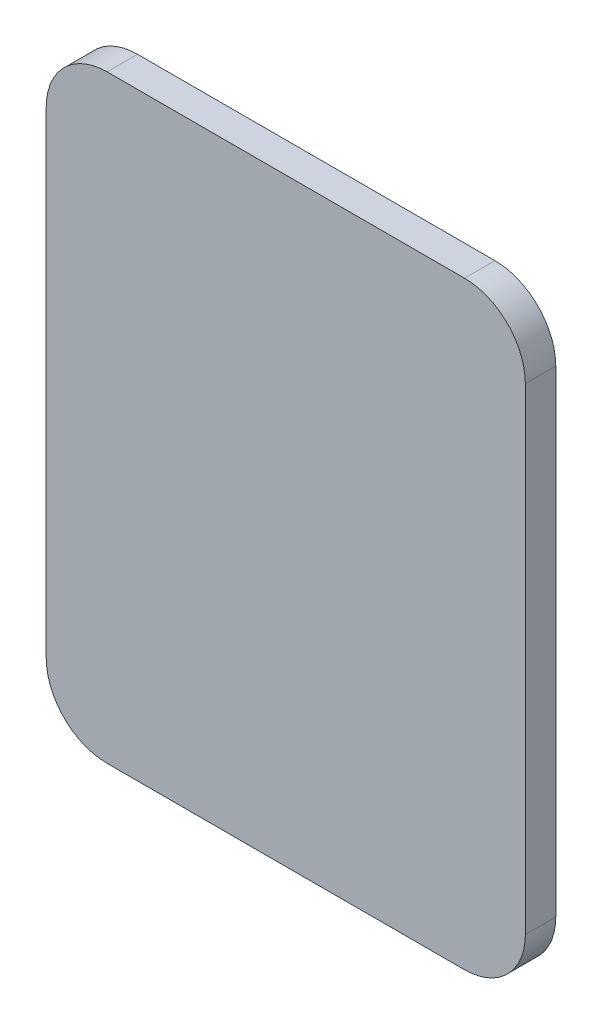
from build123d import *

# Parameters (mm, degrees)
BOSS_EXTRUDE1_DEPTH = 2.54


with BuildPart() as part:
    # Sketch1 → Boss-Extrude1 (new body)
    with BuildSketch(Plane.XY):
        with BuildLine():
            Line((-14.92, -25), (14.92, -25))
            ThreePointArc((14.92, -25), (18.512102448, -23.512102448), (20, -19.92))
            Line((20, -19.92), (20, 19.92))
            ThreePointArc((20, 19.92), (18.512102448, 23.512102448), (14.92, 25))
            Line((14.92, 25), (-14.92, 25))
            ThreePointArc((-14.92, 25), (-18.512102448, 23.512102448), (-20, 19.92))
            Line((-20, 19.92), (-20, -19.92))
            ThreePointArc((-20, -19.92), (-18.512102448, -23.512102448), (-14.92, -25))
        make_face()
    extrude(amount=BOSS_EXTRUDE1_DEPTH)


solid = part.part
